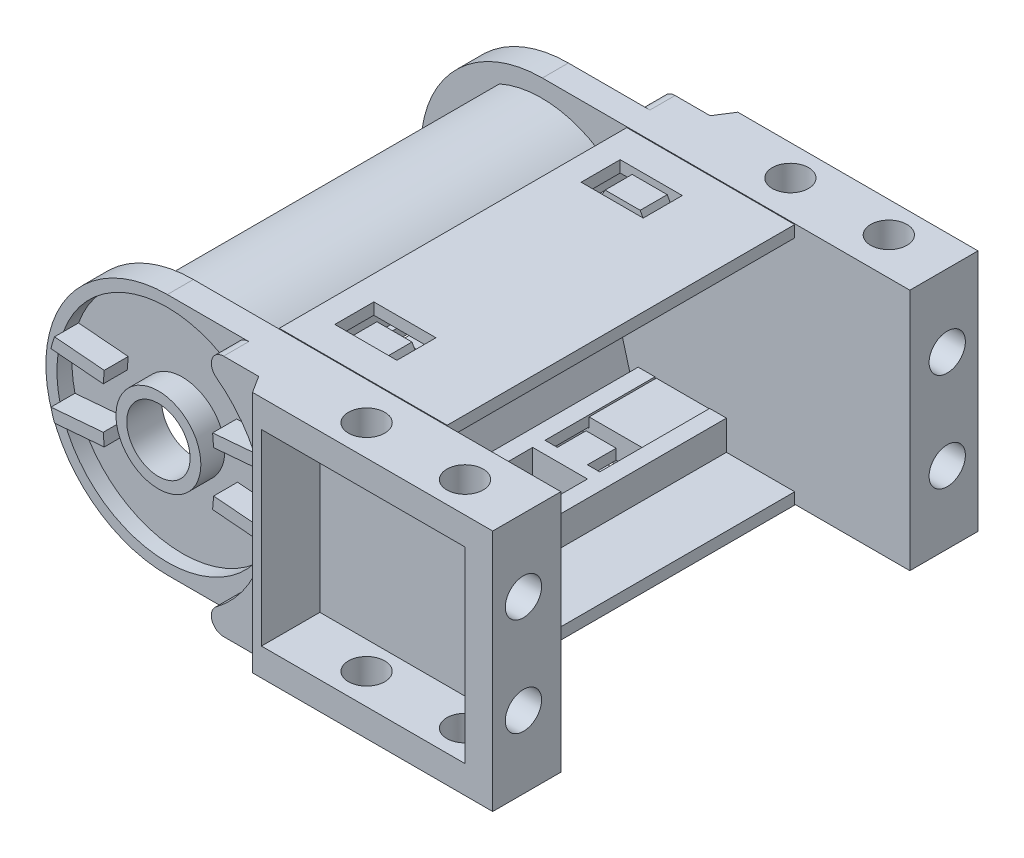
from build123d import *

# Parameters (mm, degrees)
BOSS_EXTRUDE1_START  = 39.45
BOSS_EXTRUDE1_DEPTH  = 11.08
SKETCH2_W            = 33.1
SKETCH2_H            = 30.5
CUT_EXTRUDE1_DEPTH   = 9.5
CUT_EXTRUDE2_DEPTH   = 2.75
CHAMFER1_SIZE2       = 1.75
CHAMFER1_SIZE        = 2.75
SKETCH20_R           = 20.15
CUT_EXTRUDE10_DEPTH  = 4.1
FILLET3_R            = 2
SKETCH21_R           = 17.95
CUT_EXTRUDE11_DEPTH  = 2.45
SKETCH22_R           = 5.15
CUT_EXTRUDE12_DEPTH  = 64.613009676
BOSS_EXTRUDE11_START = 3.9
SKETCH23_R           = 6.9
SKETCH23_R_2         = 5.15
BOSS_EXTRUDE11_DEPTH = 3.9
SKETCH6_R            = 2.95
CUT_EXTRUDE4_DEPTH   = 82.771724942
CUT_EXTRUDE5_REACH   = 92.921
SKETCH7_R            = 2.95
BOSS_EXTRUDE4_DEPTH  = 10.92
BOSS_EXTRUDE5_START  = -1.1
BOSS_EXTRUDE5_DEPTH  = 4.4
BOSS_EXTRUDE6_DEPTH  = 28.25
SKETCH15_W           = 10.1
SKETCH15_H           = 6.35
CUT_EXTRUDE9_DEPTH   = 5
BOSS_EXTRUDE7_REACH  = 80.754
SKETCH16_W           = 14.35
SKETCH16_H           = 20.75
SKETCH16_W_2         = 8.9
SKETCH16_H_2         = 16.75
SKETCH17_W           = 4.9
SKETCH17_H           = 4.675
BOSS_EXTRUDE8_DEPTH  = 1.7


with BuildPart() as part:
    # Sketch1 → Boss-Extrude1 (new body)
    with BuildSketch(Plane.XY.offset(BOSS_EXTRUDE1_START)):
        with BuildLine():
            Line((0, 19.75), (59.75, 19.75))
            Line((59.75, 19.75), (59.75, -19.75))
            Line((59.75, -19.75), (0, -19.75))
            ThreePointArc((0, -19.75), (-19.75, 0), (0, 19.75))
        make_face()
    extrude(amount=-BOSS_EXTRUDE1_DEPTH)

    # Sketch2 → Cut-Extrude1 (cut)
    with BuildSketch(Plane.XY.offset(39.45)):
        with Locations((38.7, 0)):
            Rectangle(SKETCH2_W, SKETCH2_H)
    extrude(amount=-CUT_EXTRUDE1_DEPTH, mode=Mode.SUBTRACT)

    # Sketch3 → Cut-Extrude2 (cut)
    with BuildSketch(Plane.XY.offset(39.45)):
        with BuildLine():
            Line((0, -19.75), (18.95, -19.75))
            Line((18.95, -19.75), (18.95, 19.75))
            Line((18.95, 19.75), (0, 19.75))
            ThreePointArc((0, 19.75), (-19.75, 0), (0, -19.75))
        make_face()
    extrude(amount=-CUT_EXTRUDE2_DEPTH, mode=Mode.SUBTRACT)

    # Chamfer1
    chamfer1_edges = [part.edges().sort_by_distance(p)[0] for p in [
        (18.95, 0, 39.45),
    ]]
    chamfer1_side = [part.faces().sort_by_distance(p)[0] for p in [
        (18.95, 0, 39.415),
    ]]
    chamfer(chamfer1_edges, length=CHAMFER1_SIZE - 0.0001, length2=CHAMFER1_SIZE2 - 0.0001, reference=chamfer1_side[0])  # a hair under: the kernel refuses the full size

    # Sketch20 → Cut-Extrude10 (cut)
    with BuildSketch(Plane.XY.offset(36.7)):
        Circle(SKETCH20_R)
    extrude(amount=-CUT_EXTRUDE10_DEPTH, mode=Mode.SUBTRACT)

    # Fillet3
    fillet3_edges = [part.edges().sort_by_distance(p)[0] for p in [
        (3.994996871, 19.75, 34.65),
        (3.994996871, -19.75, 34.65),
    ]]
    fillet(fillet3_edges, radius=FILLET3_R)

    # Sketch21 → Cut-Extrude11 (cut)
    with BuildSketch(Plane.XY.offset(32.6)):
        Circle(SKETCH21_R)
    extrude(amount=-CUT_EXTRUDE11_DEPTH, mode=Mode.SUBTRACT)

    # Sketch22 → Cut-Extrude12 (cut, through all)
    with BuildSketch(Plane.XY.offset(30.15)):
        Circle(SKETCH22_R)
    extrude(amount=-CUT_EXTRUDE12_DEPTH, mode=Mode.SUBTRACT)

    # Sketch23 → Boss-Extrude11 (add)
    # profile 1 of 5: a face of its own
    with BuildSketch(Plane.XY.offset(30.15).offset(BOSS_EXTRUDE11_START)):
        Circle(SKETCH23_R)
        Circle(SKETCH23_R_2, mode=Mode.SUBTRACT)
    # profile 2 of 5: a face of its own
    with BuildSketch(Plane.XY.offset(30.15).offset(BOSS_EXTRUDE11_START)):
        with BuildLine():
            Line((16.890733406, 6.075), (8.806513597, 5.4))
            Line((8.806513597, 5.4), (8.972926519, 3.40693534))
            Line((8.972926519, 3.40693534), (17.471594029, 4.116540064))
            ThreePointArc((17.471594029, 4.116540064), (17.2090464, 5.104039771), (16.890733406, 6.075))
        make_face()
    # profile 3 of 5: a face of its own
    with BuildSketch(Plane.XY.offset(30.15).offset(BOSS_EXTRUDE11_START)):
        with BuildLine():
            Line((17.471594029, -4.116540064), (8.972926519, -3.40693534))
            Line((8.972926519, -3.40693534), (8.806513597, -5.4))
            Line((8.806513597, -5.4), (16.890733406, -6.075))
            ThreePointArc((16.890733406, -6.075), (17.2090464, -5.104039771), (17.471594029, -4.116540064))
        make_face()
    # profile 4 of 5: a face of its own
    with BuildSketch(Plane.XY.offset(30.15).offset(BOSS_EXTRUDE11_START)):
        with BuildLine():
            Line((-8.806513597, -5.4), (-8.972926519, -3.40693534))
            Line((-8.972926519, -3.40693534), (-17.471594029, -4.116540064))
            ThreePointArc((-17.471594029, -4.116540064), (-17.2090464, -5.104039771), (-16.890733406, -6.075))
            Line((-16.890733406, -6.075), (-8.806513597, -5.4))
        make_face()
    # profile 5 of 5: a face of its own
    with BuildSketch(Plane.XY.offset(30.15).offset(BOSS_EXTRUDE11_START)):
        with BuildLine():
            Line((-17.471594029, 4.116540064), (-8.972926519, 3.40693534))
            Line((-8.972926519, 3.40693534), (-8.806513597, 5.4))
            Line((-8.806513597, 5.4), (-16.890733406, 6.075))
            ThreePointArc((-16.890733406, 6.075), (-17.2090464, 5.104039771), (-17.471594029, 4.116540064))
        make_face()
    extrude(amount=-BOSS_EXTRUDE11_DEPTH)

    # Sketch6 → Cut-Extrude4 (cut, through all)
    with BuildSketch(Plane(origin=(0, 19.75, 0), x_dir=(1, 0, 0), z_dir=(0, 1, 0))):
        with Locations(Location((50.25, -34.45, 0), (0, 0, 270))):
            Circle(SKETCH6_R)
        with Locations(Location((34.25, -34.45, 0), (0, 0, 270))):
            Circle(SKETCH6_R)
    extrude(amount=-CUT_EXTRUDE4_DEPTH, mode=Mode.SUBTRACT)

    # Sketch7 → Cut-Extrude5 (cut, up to next)
    with BuildSketch(Plane(origin=(59.75, 0, 0), x_dir=(0, 0, -1), z_dir=(1, 0, 0)), mode=Mode.PRIVATE) as cut_extrude5_sk1:
        with Locations((-34.45, 8)):
            Circle(SKETCH7_R)
    cut_extrude5_tool1 = extrude(cut_extrude5_sk1.sketch, amount=-CUT_EXTRUDE5_REACH, mode=Mode.PRIVATE) & part.part
    # Sketch7 → Cut-Extrude5 (cut, up to next)
    with BuildSketch(Plane(origin=(59.75, 0, 0), x_dir=(0, 0, -1), z_dir=(1, 0, 0)), mode=Mode.PRIVATE) as cut_extrude5_sk2:
        with Locations((-34.45, -8)):
            Circle(SKETCH7_R)
    cut_extrude5_tool2 = extrude(cut_extrude5_sk2.sketch, amount=-CUT_EXTRUDE5_REACH, mode=Mode.PRIVATE) & part.part
    add(cut_extrude5_tool1.solids().sort_by_distance((59.75, 8, 34.45))[0], mode=Mode.SUBTRACT)
    add(cut_extrude5_tool2.solids().sort_by_distance((59.75, -8, 34.45))[0], mode=Mode.SUBTRACT)

    # Sketch12 → Boss-Extrude4 (add)
    with BuildSketch(Plane(origin=(0, 0, 28.37), x_dir=(-1, 0, 0), z_dir=(0, 0, -1))):
        Polygon((-27.425, 17.15), (-18.325, 17.15), (-17.5, 15.65), (-17.5, 14.85), (-18.525, 14.85), (-18.525, 13.25), (-27.225, 13.25), (-27.225, 14.85), (-28.25, 14.85), (-28.25, 15.65), align=None)
        Polygon((-17.5, -15.65), (-17.5, -14.85), (-18.525, -14.85), (-18.525, -13.25), (-27.225, -13.25), (-27.225, -14.85), (-28.25, -14.85), (-28.25, -15.65), (-27.425, -17.15), (-18.325, -17.15), align=None)
    extrude(amount=BOSS_EXTRUDE4_DEPTH)

    # Sketch13 → Boss-Extrude5 (add)
    with BuildSketch(Plane(origin=(0, 0, 17.45), x_dir=(-1, 0, 0), z_dir=(0, 0, -1)).offset(BOSS_EXTRUDE5_START)):
        Polygon((-26.7, 17.15), (-25.725, 18.9), (-20.025, 18.9), (-19.05, 17.15), align=None)
        Polygon((-20.025, -18.9), (-19.05, -17.15), (-26.7, -17.15), (-25.725, -18.9), align=None)
    extrude(amount=-BOSS_EXTRUDE5_DEPTH)


with BuildPart() as body_2:
    # Sketch14 → Boss-Extrude6 (new, symmetric)
    with BuildSketch(Plane.XY):
        with BuildLine():
            Line((41.15, 19.75), (13.85, 19.75))
            Line((13.85, 19.75), (11.787175234, 12.25))
            ThreePointArc((11.787175234, 12.25), (2.971704939, 16.738248706), (-6.85, 15.558839931))
            Line((-6.85, 15.558839931), (-6.092470588, 13.83821528))
            ThreePointArc((-6.092470588, 13.83821528), (4.294757816, 14.497222331), (12.646917657, 8.286728775))
            Line((12.646917657, 8.286728775), (15.28273222, 17.87))
            Line((15.28273222, 17.87), (15.7, 17.87))
            Line((15.7, 17.87), (15.7, 13.05))
            Line((15.7, 13.05), (18.425, 13.05))
            Line((18.425, 13.05), (18.425, 14.75))
            Line((18.425, 14.75), (17.4, 14.75))
            Line((17.4, 14.75), (17.4, 17.87))
            Line((17.4, 17.87), (28.35, 17.87))
            Line((28.35, 17.87), (28.35, 14.75))
            Line((28.35, 14.75), (27.325, 14.75))
            Line((27.325, 14.75), (27.325, 13.05))
            Line((27.325, 13.05), (30.05, 13.05))
            Line((30.05, 13.05), (30.05, 17.87))
            Line((30.05, 17.87), (41.15, 17.87))
            Line((41.15, 17.87), (41.15, 19.75))
        make_face()
    extrude(amount=BOSS_EXTRUDE6_DEPTH, both=True)

    # Sketch15 → Cut-Extrude9 (cut)
    with BuildSketch(Plane(origin=(0, 19.75, 0), x_dir=(1, 0, 0), z_dir=(0, 1, 0))):
        with Locations((22.875, -20.025)):
            Rectangle(SKETCH15_W, SKETCH15_H)
        with Locations((22.875, 20.025)):
            Rectangle(SKETCH15_W, SKETCH15_H)
    extrude(amount=-CUT_EXTRUDE9_DEPTH, mode=Mode.SUBTRACT)

    # Boss-Extrude7: up to this face of the body (flat: up to its plane)
    boss_extrude7_end = Plane(body_2.part.faces().sort_by_distance((35.6, 17.87, 0))[0])
    # Sketch16 → Boss-Extrude7 (add, up to the picked face)
    with BuildSketch(Plane.XZ.offset(-13.05), mode=Mode.PRIVATE) as boss_extrude7_sk1:
        with Locations((22.875, 0)):
            Rectangle(SKETCH16_W, SKETCH16_H)
        with Locations((22.875, 0)):
            Rectangle(SKETCH16_W_2, SKETCH16_H_2, mode=Mode.SUBTRACT)
    boss_extrude7_tool1 = split(extrude(boss_extrude7_sk1.sketch, amount=-BOSS_EXTRUDE7_REACH, mode=Mode.PRIVATE), bisect_by=boss_extrude7_end, keep=Keep.BOTH, mode=Mode.PRIVATE)
    add(boss_extrude7_tool1.solids().sort_by(Axis((22.875, 13.05, 10.122713), (0, 1, 0)))[0])

    # Sketch17 → Boss-Extrude8 (add)
    with BuildSketch(Plane.XZ.offset(-13.05)):
        with Locations((22.875, 12.7125)):
            Rectangle(SKETCH17_W, SKETCH17_H)
        with Locations((22.875, -12.7125)):
            Rectangle(SKETCH17_W, SKETCH17_H)
    extrude(amount=-BOSS_EXTRUDE8_DEPTH)


with BuildPart() as body_3:
    # Mirror1: mirrored copy
    add(part.part.mirror(Plane.XY))


with BuildPart() as body_4:
    # Mirror2: mirrored copy
    add(body_2.part.mirror(Plane.ZX))


solid = Compound([part.part, body_2.part, body_3.part, body_4.part])
